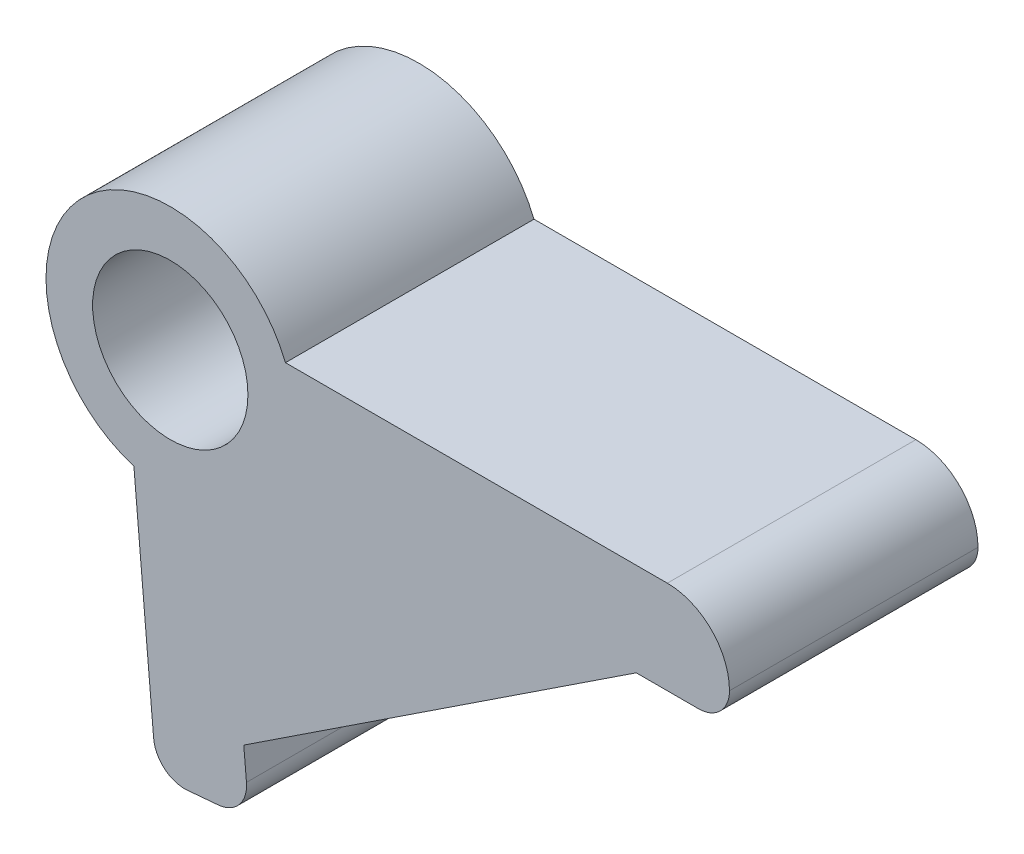
from build123d import *

# Parameters (mm, degrees)
SKETCH1_R           = 2.5
BOSS_EXTRUDE1_DEPTH = 8
FILLET1_R           = 1
FILLET2_R           = 2


with BuildPart() as part:
    # Sketch1 → Boss-Extrude1 (new body)
    with BuildSketch(Plane.XY):
        with BuildLine():
            Line((-0.448423134, -12.085069991), (2.54016096, -11.823602763))
            Line((2.54016096, -11.823602763), (2.365849475, -9.831213367))
            Line((2.365849475, -9.831213367), (15, -1.5))
            Line((15, -1.5), (18, -1.5))
            Line((18, -1.5), (18, 1.5))
            Line((18, 1.5), (3.708099244, 1.5))
            ThreePointArc((3.708099244, 1.5), (-2.949109347, 2.70236083), (-1.171109903, -3.824722421))
            Line((-1.171109903, -3.824722421), (-0.448423134, -12.085069991))
        make_face()
        Circle(SKETCH1_R, mode=Mode.SUBTRACT)
    extrude(amount=BOSS_EXTRUDE1_DEPTH)

    # Fillet1
    fillet1_edges = [part.edges().sort_by_distance(p)[0] for p in [
        (2.54016096, -11.823602763, 4),
        (18, -1.5, 4),
        (-0.448423134, -12.085069991, 4),
    ]]
    fillet(fillet1_edges, radius=FILLET1_R)

    # Fillet2
    fillet2_edges = [part.edges().sort_by_distance(p)[0] for p in [
        (18, 1.5, 4),
    ]]
    fillet(fillet2_edges, radius=FILLET2_R - 0.0001)  # a hair under: the kernel refuses the full size


solid = part.part
